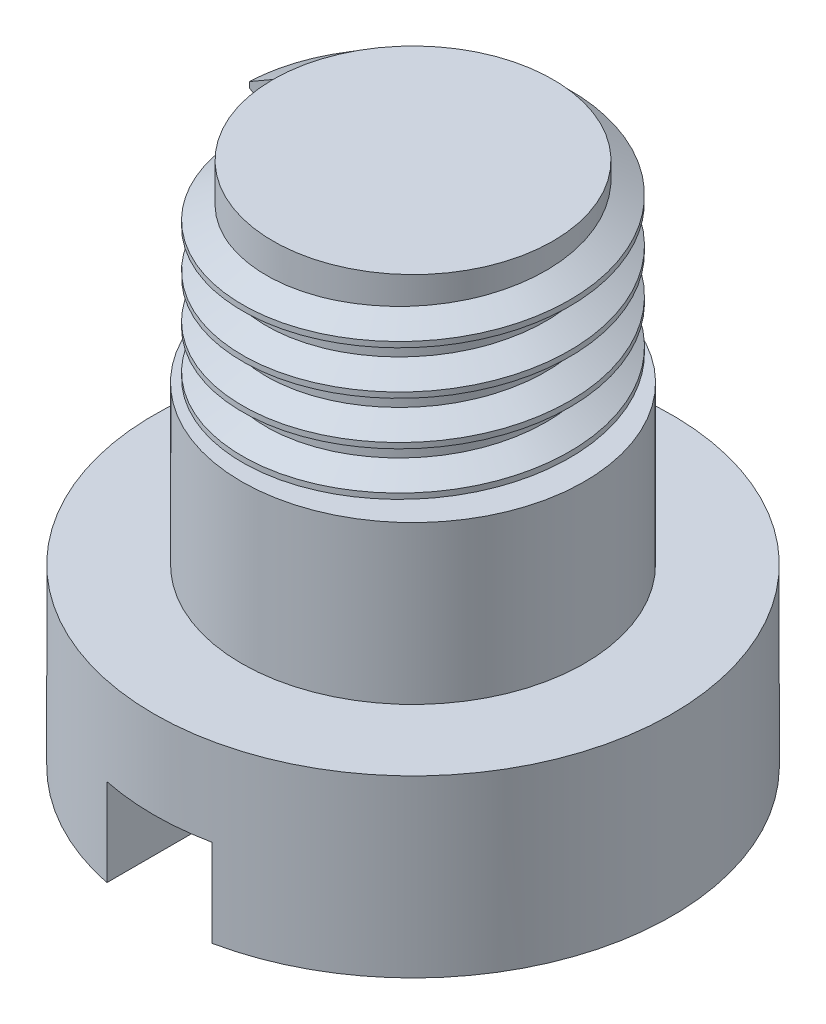
from build123d import *

# Parameters (mm, degrees)
SKETCH1_R           = 7.4
BOSS_EXTRUDE1_DEPTH = 5
SKETCH2_R           = 4.9
BOSS_EXTRUDE2_DEPTH = 10
SKETCH13_OUTSIDE_W  = 21.95
SKETCH13_OUTSIDE_H  = 21.95
SKETCH13_OUTSIDE_R  = 4
CUT_EXTRUDE4_DEPTH  = 5.5
THREAD2_PITCH       = 1.25
SKETCH5_W           = 3
SKETCH5_H           = 14.8
CUT_EXTRUDE5_DEPTH  = 2.5


with BuildPart() as part:
    # Sketch1 → Boss-Extrude1 (new body)
    with BuildSketch(Plane(origin=(0, 0, 0), x_dir=(1, 0, 0), z_dir=(0, 1, 0))):
        with Locations(Location((0, 0, 0), (0, 0, 270))):
            Circle(SKETCH1_R)
    extrude(amount=BOSS_EXTRUDE1_DEPTH)

    # Sketch2 → Boss-Extrude2 (add)
    with BuildSketch(Plane(origin=(0, 5, 0), x_dir=(1, 0, 0), z_dir=(0, 1, 0))):
        with Locations(Location((0, 0, 0), (0, 0, 270))):
            Circle(SKETCH2_R)
    extrude(amount=BOSS_EXTRUDE2_DEPTH)

    # Sketch13 outside → Cut-Extrude4 (cut)
    with BuildSketch(Plane(origin=(0, 15, 0), x_dir=(1, 0, 0), z_dir=(0, 1, 0))):
        Rectangle(SKETCH13_OUTSIDE_W, SKETCH13_OUTSIDE_H)
        with Locations(Location((0, 0, 0), (0, 0, 270))):
            Circle(SKETCH13_OUTSIDE_R, mode=Mode.SUBTRACT)
    extrude(amount=-CUT_EXTRUDE4_DEPTH, mode=Mode.SUBTRACT)

    # Thread2: the profile of Thread Profile4 profile screwed along a right-hand helix of 4.4 turns, 8 arcs to a turn; built about Z, then put on its axis
    thread2_z = Axis((0, 0, 0), (0, 0, 1))
    thread2_corners = [(3.9997, 0, -0.000173205), (4.676582344, 0, 0.390624998), (4.676582344, 0, 0.546874998), (3.9997, 0, 0.937673202)]
    with BuildLine(mode=Mode.PRIVATE) as thread2_profile:
        Line(thread2_corners[0], thread2_corners[1])
        Line(thread2_corners[1], thread2_corners[2])
        Line(thread2_corners[2], thread2_corners[3])
        Line(thread2_corners[3], thread2_corners[0])
    thread2_cap = Face(thread2_profile.wire())
    thread2_turn_angles = [0, 22.5, 45, 67.5, 90, 112.5, 135, 157.5, 180, 202.5, 225, 247.5, 270, 292.5, 315, 337.5, 360]
    thread2_turn_weights = [1, 0.9238795325112867, 1, 0.9238795325112867, 1, 0.9238795325112867, 1, 0.9238795325112867, 1, 0.9238795325112867, 1, 0.9238795325112867, 1, 0.9238795325112867, 1, 0.9238795325112867, 1]
    thread2_turn_rails = [Edge.make_bspline([Vector(p[0], p[1], 0).rotate(thread2_z, thread2_turn_angles[k]) / thread2_turn_weights[k] + Vector(0, 0, p[2] + THREAD2_PITCH * thread2_turn_angles[k] / 360) for k in range(17)], [0, 0, 0, 1, 1, 2, 2, 3, 3, 4, 4, 5, 5, 6, 6, 7, 7, 8, 8, 8], 2, thread2_turn_weights) for p in thread2_corners]
    thread2_turn_sides = [Face.make_surface_from_curves(thread2_turn_rails[p[0]], thread2_turn_rails[p[1]]) for p in [(0, 1), (1, 2), (2, 3), (3, 0)]]
    thread2_last_angles = [1440, 1462.5, 1485, 1507.5, 1530, 1552.5, 1575, 1579.5, 1584]
    thread2_last_weights = [1, 0.9238795325112867, 1, 0.9238795325112867, 1, 0.9238795325112867, 1, 0.996917333733128, 1]
    thread2_last_rails = [Edge.make_bspline([Vector(p[0], p[1], 0).rotate(thread2_z, thread2_last_angles[k]) / thread2_last_weights[k] + Vector(0, 0, p[2] + THREAD2_PITCH * thread2_last_angles[k] / 360) for k in range(9)], [0, 0, 0, 1, 1, 2, 2, 3, 3, 4, 4, 4], 2, thread2_last_weights) for p in thread2_corners]
    thread2_last_sides = [Face.make_surface_from_curves(thread2_last_rails[p[0]], thread2_last_rails[p[1]]) for p in [(0, 1), (1, 2), (2, 3), (3, 0)]]
    thread2 = Plane(origin=(0, 15, 0), x_dir=(-1, 0, 0), z_dir=(0, -1, 0)) * Solid(Shell([*[p.moved(Location((0, 0, THREAD2_PITCH * i))) for i in range(4) for p in thread2_turn_sides], *thread2_last_sides, thread2_cap, thread2_cap.rotate(thread2_z, 1584).moved(Location((0, 0, THREAD2_PITCH * 1584 / 360)))]))
    add(thread2)

    # Sketch5 → Cut-Extrude5 (cut)
    with BuildSketch(Plane.XZ):
        Rectangle(SKETCH5_W, SKETCH5_H)
    extrude(amount=-CUT_EXTRUDE5_DEPTH, mode=Mode.SUBTRACT)


solid = part.part
